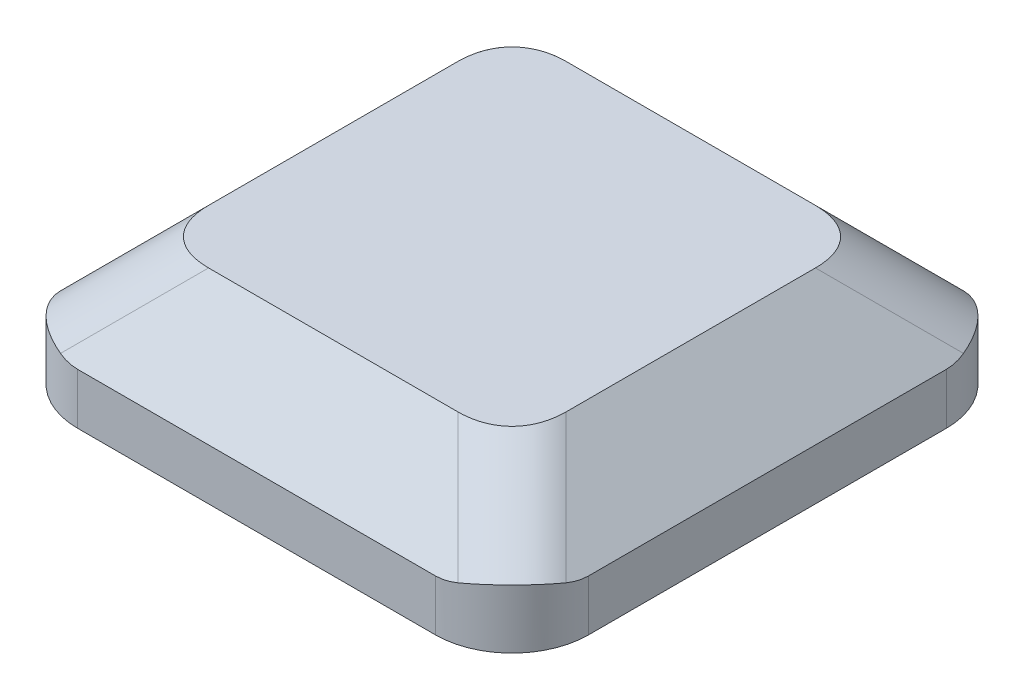
from build123d import *

# Parameters (mm, degrees)
SKETCH1_W           = 20
SKETCH1_H           = 20
BOSS_EXTRUDE1_DEPTH = 5
CHAMFER1_SIZE       = 3
FILLET1_R           = 3


with BuildPart() as part:
    # Sketch1 → Boss-Extrude1 (new body)
    with BuildSketch(Plane(origin=(0, 0, 0), x_dir=(1, 0, 0), z_dir=(0, 1, 0))):
        with Locations((10, 10)):
            Rectangle(SKETCH1_W, SKETCH1_H)
    extrude(amount=BOSS_EXTRUDE1_DEPTH)

    # Chamfer1
    chamfer1_edges = [part.edges().sort_by_distance(p)[0] for p in [
        (10, 5, -20),
        (0, 5, -10),
        (10, 5, 0),
        (20, 5, -10),
    ]]
    chamfer(chamfer1_edges, length=CHAMFER1_SIZE)

    # Fillet1
    # the kernel refuses this fillet: 3 mm, written as the material it takes off along each edge
    with BuildSketch(Plane(origin=(0, -7.5, 0), x_dir=(0, 0, -1), z_dir=(0, 1, 0)), Plane(origin=(0, -7.5, -20), x_dir=(1, 0, 0), z_dir=(0, 1, 0))) as fillet1_piece_1:
        with BuildLine():
            CenterArc((FILLET1_R, -FILLET1_R), FILLET1_R, 90, 90)
            Line((0, -FILLET1_R), (0, 0))
            Line((0, 0), (FILLET1_R, 0))
        make_face()
    extrude(amount=17, mode=Mode.SUBTRACT)
    with BuildSketch(Plane(origin=(20, -7.5, -20), x_dir=(-1, 0, 0), z_dir=(0, 1, 0)), Plane(origin=(20, -7.5, 0), x_dir=(0, 0, -1), z_dir=(0, 1, 0))) as fillet1_piece_2:
        with BuildLine():
            CenterArc((FILLET1_R, FILLET1_R), FILLET1_R, 180, 90)
            Line((0, FILLET1_R), (0, 0))
            Line((0, 0), (FILLET1_R, 0))
        make_face()
    extrude(amount=17, mode=Mode.SUBTRACT)
    with BuildSketch(Plane(origin=(22.5, -0.5, -22.5), x_dir=(-0.8164965809277263, -0.4082482904638636, -0.408248290463862), z_dir=(-0.5773502691896255, 0.577350269189626, 0.577350269189626)), Plane(origin=(22.5, -0.5, 2.5), x_dir=(0.4082482904638631, -0.4082482904638628, -0.8164965809277261), z_dir=(-0.5773502691896261, 0.5773502691896256, -0.5773502691896256))) as fillet1_piece_3:
        with BuildLine():
            CenterArc((FILLET1_R * 0.57735026919, FILLET1_R), FILLET1_R, 210, 60)
            Line((-FILLET1_R * 0.288675134595, FILLET1_R * 0.5), (0, 0))
            Line((0, 0), (FILLET1_R * 0.57735026919, 0))
        make_face()
    extrude(amount=13.856406461, mode=Mode.SUBTRACT)
    with BuildSketch(Plane(origin=(-2.5, -0.5, -22.5), x_dir=(0.8164965809277259, -0.40824829046386324, -0.40824829046386274), z_dir=(0.5773502691896258, 0.5773502691896258, 0.5773502691896258)), Plane(origin=(-2.5, -0.5, 2.5), x_dir=(-0.40824829046386274, -0.4082482904638633, -0.816496580927726), z_dir=(0.5773502691896258, 0.5773502691896258, -0.5773502691896258))) as fillet1_piece_4:
        with BuildLine():
            CenterArc((FILLET1_R * 0.57735026919, -FILLET1_R), FILLET1_R, 90, 60)
            Line((-FILLET1_R * 0.288675134595, -FILLET1_R * 0.5), (0, 0))
            Line((0, 0), (FILLET1_R * 0.57735026919, 0))
        make_face()
    extrude(amount=13.856406461, mode=Mode.SUBTRACT)


solid = part.part
